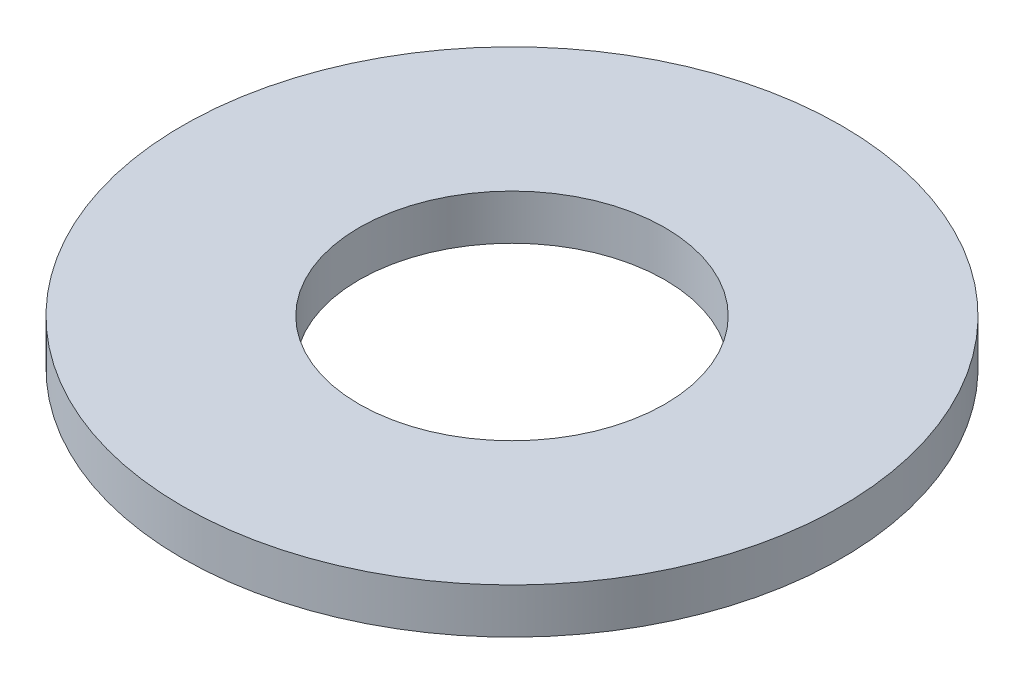
from build123d import *

# Parameters (mm, degrees)
SKETCH1_R           = 11.1125
BOSS_EXTRUDE1_DEPTH = 1.524
SKETCH5_R           = 5.1562
CUT_EXTRUDE1_DEPTH  = 16.789169975


with BuildPart() as part:
    # Sketch1 → Boss-Extrude1 (new body)
    with BuildSketch(Plane(origin=(0, 0, 0), x_dir=(1, 0, 0), z_dir=(0, 1, 0))):
        Circle(SKETCH1_R)
    extrude(amount=BOSS_EXTRUDE1_DEPTH)

    # Sketch5 → Cut-Extrude1 (cut, through all)
    with BuildSketch(Plane(origin=(0, 1.524, 0), x_dir=(-1, 0, 0), z_dir=(0, 1, 0))):
        Circle(SKETCH5_R)
    extrude(amount=-CUT_EXTRUDE1_DEPTH, mode=Mode.SUBTRACT)


solid = part.part
